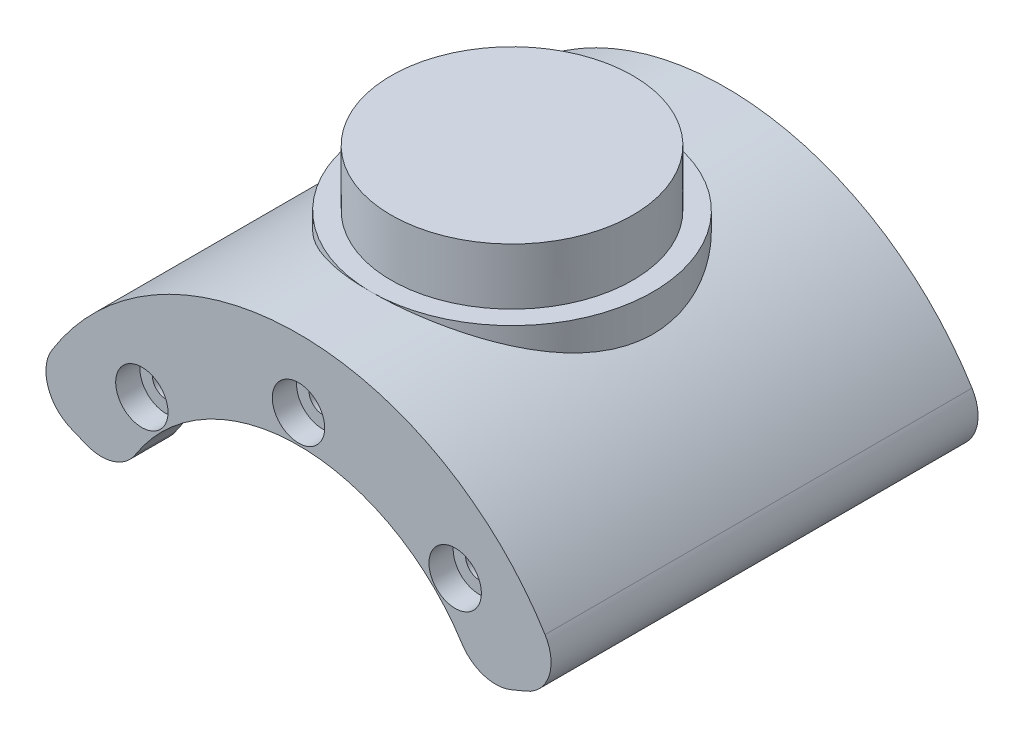
from build123d import *

# Parameters (mm, degrees)
SKETCH_1_R                   = 36
EXTRUDE_1_DEPTH              = 26.5
CUT_EXTRUDE_3_DEPTH          = 58.395557319
CUT_EXTRUDE_3_DEPTH_BACK     = 58.395557319
SKETCH_5_R                   = 24
CUT_EXTRUDE_4_DEPTH          = 74.491496107
CUT_EXTRUDE_4_DEPTH_BACK     = 74.491496107
CUT_EXTRUDE_2_DEPTH          = 21.5
HOLE_WIZARD_M3_1_D           = 3.4
HOLE_WIZARD_M3_1_DEPTH       = 5
HOLE_WIZARD_M3_1_CBORE_D     = 6.5
HOLE_WIZARD_M3_1_CBORE_DEPTH = 3
PATTERN_CIRCULAR_1_COUNT     = 2
PATTERN_CIRCULAR_1_ANGLE     = 45
F_1_THE_OTHER_WAY_COUNT      = 2
F_1_THE_OTHER_WAY_ANGLE      = 45
MIRROR_1_COPY_1_D            = 3.4
MIRROR_1_COPY_1_DEPTH        = 5
MIRROR_1_COPY_1_CBORE_D      = 6.5
MIRROR_1_COPY_1_CBORE_DEPTH  = 3
MIRROR_1_COPY_2_D            = 3.4
MIRROR_1_COPY_2_DEPTH        = 5
MIRROR_1_COPY_2_CBORE_D      = 6.5
MIRROR_1_COPY_2_CBORE_DEPTH  = 3
FILLET_1_R                   = 5
SKETCH_10_R                  = 17.5
EXTRUDE_2_DEPTH              = 5
SKETCH_17_R                  = 15
EXTRUDE_3_DEPTH              = 7


with BuildPart() as part:
    # ｽｹｯﾁ1 → ﾎﾞｽ - 押し出し1 (new, symmetric)
    with BuildSketch(Plane.XY):
        Circle(SKETCH_1_R)
    extrude(amount=EXTRUDE_1_DEPTH, both=True)

    # ｽｹｯﾁ5 → ｶｯﾄ - 押し出し3 (cut, two sides: drawn at the far end of the back side and taken through both)
    with BuildSketch(Plane.XY.offset(-CUT_EXTRUDE_3_DEPTH_BACK)):
        Circle(SKETCH_5_R)
    extrude(amount=CUT_EXTRUDE_3_DEPTH + CUT_EXTRUDE_3_DEPTH_BACK, mode=Mode.SUBTRACT)

    # ｽｹｯﾁ6 → ｶｯﾄ - 押し出し4 (cut, two sides: drawn at the far end of the back side and taken through both)
    with BuildSketch(Plane.XY.offset(26.5).offset(-CUT_EXTRUDE_4_DEPTH_BACK)):
        with BuildLine():
            Line((-33.25966317, 13.776603565), (0, 0))
            Line((0, 0), (33.25966317, 13.776603565))
            ThreePointArc((33.25966317, 13.776603565), (0, -36), (-33.25966317, 13.776603565))
        make_face()
    extrude(amount=CUT_EXTRUDE_4_DEPTH + CUT_EXTRUDE_4_DEPTH_BACK, mode=Mode.SUBTRACT)

    # ｽｹｯﾁ3 → ｶｯﾄ - 押し出し2 (cut, symmetric)
    with BuildSketch(Plane.XY):
        with BuildLine():
            Line((-33.25966317, 13.776603565), (-28.640265508, 11.863186403))
            ThreePointArc((-28.640265508, 11.863186403), (0, 31), (28.640265508, 11.863186403))
            Line((28.640265508, 11.863186403), (33.25966317, 13.776603565))
            ThreePointArc((33.25966317, 13.776603565), (0, -36), (-33.25966317, 13.776603565))
        make_face()
    extrude(amount=CUT_EXTRUDE_2_DEPTH, both=True, mode=Mode.SUBTRACT)

    # M3 穴付きねじ用座ぐり穴1
    with Locations(Plane.XY.offset(26.5)):
        with Locations((0, 27.5)):
            hole_wizard_m3_1 = CounterBoreHole(HOLE_WIZARD_M3_1_D / 2, HOLE_WIZARD_M3_1_CBORE_D / 2, HOLE_WIZARD_M3_1_CBORE_DEPTH, depth=HOLE_WIZARD_M3_1_DEPTH)

    # 円形ﾊﾟﾀｰﾝ1: M3 穴付きねじ用座ぐり穴1 ×2 about axis
    pattern_circular_1_axis = Axis((0, 0, 26.5), (0, 0, -1))
    for i in range(1, PATTERN_CIRCULAR_1_COUNT):
        add(hole_wizard_m3_1.rotate(pattern_circular_1_axis, i * PATTERN_CIRCULAR_1_ANGLE / (PATTERN_CIRCULAR_1_COUNT - 1)), mode=Mode.SUBTRACT)

    # 1 the other way: M3 穴付きねじ用座ぐり穴1 ×2 about axis
    f_1_the_other_way_axis = Axis((0, 0, 26.5), (0, 0, 1))
    for i in range(1, F_1_THE_OTHER_WAY_COUNT):
        add(hole_wizard_m3_1.rotate(f_1_the_other_way_axis, i * F_1_THE_OTHER_WAY_ANGLE / (F_1_THE_OTHER_WAY_COUNT - 1)), mode=Mode.SUBTRACT)

    # ﾐﾗｰ1: M3 穴付きねじ用座ぐり穴1 across plane
    add(hole_wizard_m3_1.mirror(Plane.XY), mode=Mode.SUBTRACT)

    # ﾐﾗｰ1 copy 1
    with Locations(Plane(origin=(0, 0, -26.5), x_dir=(0.7071067811865462, -0.7071067811865488, 0), z_dir=(0, 0, -1))):
        with Locations((0, -27.5)):
            CounterBoreHole(MIRROR_1_COPY_1_D / 2, MIRROR_1_COPY_1_CBORE_D / 2, MIRROR_1_COPY_1_CBORE_DEPTH, depth=MIRROR_1_COPY_1_DEPTH)

    # ﾐﾗｰ1 copy 2
    with Locations(Plane(origin=(0, 0, -26.5), x_dir=(0.7071067811865462, 0.7071067811865488, 0), z_dir=(0, 0, -1))):
        with Locations((0, -27.5)):
            CounterBoreHole(MIRROR_1_COPY_2_D / 2, MIRROR_1_COPY_2_CBORE_D / 2, MIRROR_1_COPY_2_CBORE_DEPTH, depth=MIRROR_1_COPY_2_DEPTH)

    # ﾌｨﾚｯﾄ1
    # the kernel refuses this fillet: 5 mm, written as the material it takes off along each edge
    with BuildSketch(Plane(origin=(33.25966317, 13.776603565, 41.063878514), x_dir=(-0.4561802532309845, 0.88988739543951, 0), z_dir=(0, 0, -1)), Plane(origin=(-33.25966317, 13.776603565, -41.063878514), x_dir=(0.45618025323098454, 0.88988739543951, 0), z_dir=(0, 0, 1))) as fillet_1_piece_1:
        with BuildLine():
            CenterArc((5.420999225, -4.98360688), FILLET_1_R, 85.359100457, 99.281799087)
            Line((0.437392345, -5.388159061), (0, 0))
            ThreePointArc((0, 0), (2.912775703, 0.118030465), (5.825551406, 0))
        make_face()
    extrude(amount=82.127757029, mode=Mode.SUBTRACT)
    with BuildSketch(Plane(origin=(22.17310878, 9.184402377, -37.914284285), x_dir=(0.9238795325112864, 0.38268343236509056, 0), z_dir=(0, 0, 1)), Plane(origin=(22.17310878, 9.184402377, 10.085715715), x_dir=(0.9238795325112864, 0.38268343236509056, 0), z_dir=(0, 0, 1))) as fillet_1_piece_2:
        with BuildLine():
            CenterArc((4.565713714, 5), FILLET_1_R, 189.928191842, 80.071808158)
            ThreePointArc((-0.35940934, 4.137931034), (-0.090021164, 2.076755181), (0, 0))
            Line((0, 0), (4.565713714, 0))
        make_face()
    extrude(amount=27.828568571, mode=Mode.SUBTRACT)
    with BuildSketch(Plane(origin=(-22.17310878, 9.184402377, -37.914284285), x_dir=(-0.9238795325112864, 0.38268343236509056, 0), z_dir=(0, 0, 1)), Plane(origin=(-22.17310878, 9.184402377, 10.085715715), x_dir=(-0.9238795325112864, 0.38268343236509056, 0), z_dir=(0, 0, 1))) as fillet_1_piece_3:
        with BuildLine():
            CenterArc((4.565713714, -5), FILLET_1_R, 90, 80.071808158)
            ThreePointArc((-0.35940934, -4.137931034), (-0.090021164, -2.076755181), (0, 0))
            Line((0, 0), (4.565713714, 0))
        make_face()
    extrude(amount=27.828568571, mode=Mode.SUBTRACT)

    # ｽｹｯﾁ10 → ﾎﾞｽ - 押し出し2 (add, through all)
    with BuildSketch(Plane(origin=(0, 31, 0), x_dir=(-1, 0, 0), z_dir=(0, -1, 0))):
        Circle(SKETCH_10_R)
    extrude(amount=-EXTRUDE_2_DEPTH)

    # ｽｹｯﾁ17 → ﾎﾞｽ - 押し出し3 (add)
    with BuildSketch(Plane(origin=(0, 36, 0), x_dir=(1, 0, 0), z_dir=(0, 1, 0))):
        with Locations(Location((0, 0, 0), (0, 0, 90))):
            Circle(SKETCH_17_R)
    extrude(amount=EXTRUDE_3_DEPTH)


solid = part.part
